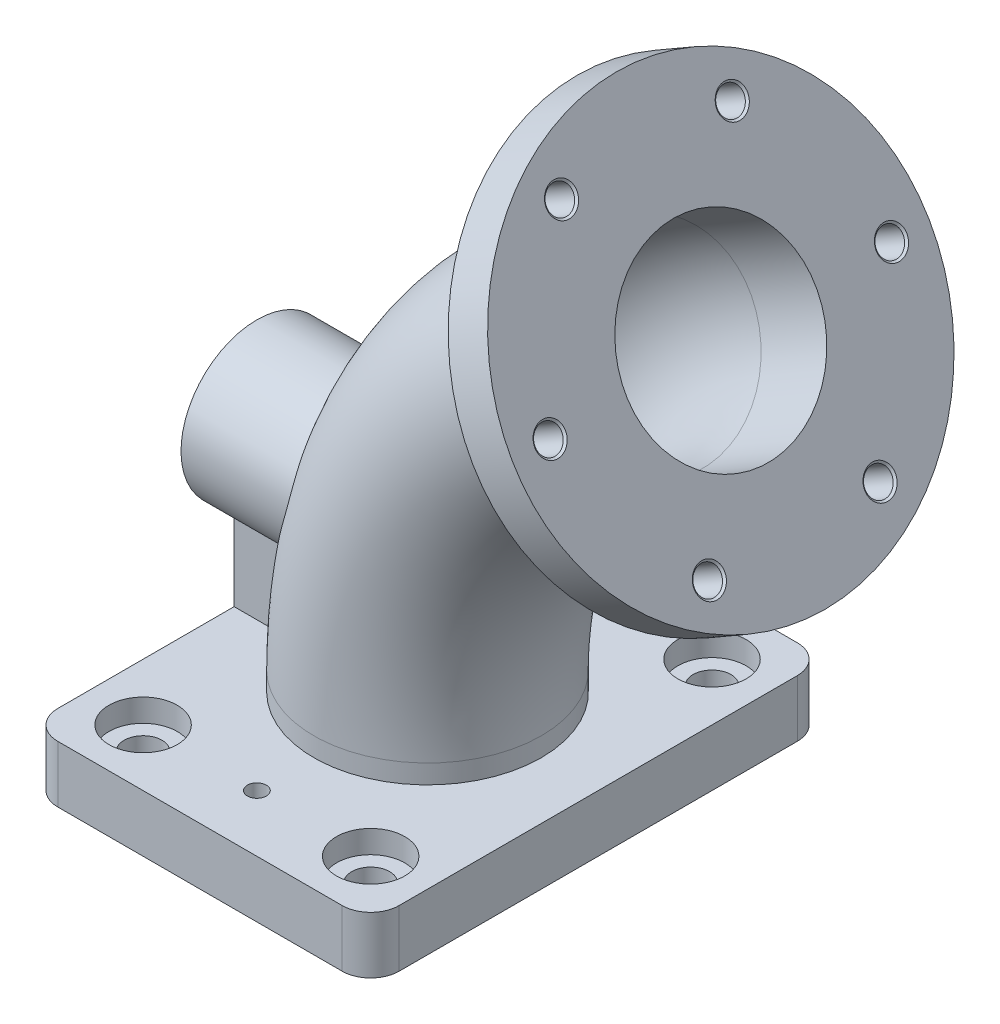
from build123d import *

# Parameters (mm, degrees)
SKETCH1_W                       = 90
SKETCH1_H                       = 15
BOSS_EXTRUDE1_DEPTH             = 60
SKETCH3_R                       = 30
SKETCH3_R_2                     = 25
SKETCH4_R                       = 55
SKETCH4_R_2                     = 25
BOSS_EXTRUDE2_DEPTH             = 12
M8X1_0_TAPPED_HOLE1_D           = 7
M8X1_0_TAPPED_HOLE1_CSINK_D     = 8.05
M8X1_0_TAPPED_HOLE1_CSINK_ANGLE = 90
FILLET1_R                       = 7.5
HOLE2_D                         = 10
HOLE2_CBORE_D                   = 18
HOLE2_CBORE_DEPTH               = 6
MIRROR2_COPY_1_D                = 10
MIRROR2_COPY_1_CBORE_D          = 18
MIRROR2_COPY_1_CBORE_DEPTH      = 6
HOLE3_D                         = 5
BOSS_EXTRUDE3_REACH             = 239.363
HOLE4_REACH                     = 239.363
HOLE4_BORE_R                    = 12.5


# Read off the part's stored shape, not the designer's step: CirPattern1
with BuildPart() as part:
    # Sketch1 → Boss-Extrude1 (new, symmetric)
    with BuildSketch(Plane.XY):
        Rectangle(SKETCH1_W, SKETCH1_H)
    extrude(amount=BOSS_EXTRUDE1_DEPTH, both=True)

    # Sweep1: sweep along a path in Sketch2
    with BuildLine(Plane.XY) as sweep1_path:
        Line((0, 7.5), (0, 12.5))
        ThreePointArc((0, 12.5), (16.076951546, 72.5), (60, 116.423048454))
        Line((60, 116.423048454), (77.320508076, 126.423048454))
    # Sketch3 → Sweep1 (sweep)
    with BuildSketch(Plane(origin=(0, 7.5, 0), x_dir=(1, 0, 0), z_dir=(0, 1, 0))):
        Circle(SKETCH3_R)
        Circle(SKETCH3_R_2, mode=Mode.SUBTRACT)
    sweep(path=sweep1_path.line)

    # Sketch4 → Boss-Extrude2 (add)
    with BuildSketch(Plane(origin=(112.733166849, 65.086524227, 0), x_dir=(0, 0, -1), z_dir=(0.8660254037844357, 0.5000000000000052, 0))):
        with Locations(Location((0, 70.825317547, 0), (0, 0, 90))):
            Circle(SKETCH4_R)
        with Locations(Location((0, 70.825317547, 0), (0, 0, 90))):
            Circle(SKETCH4_R_2, mode=Mode.SUBTRACT)
    extrude(amount=-BOSS_EXTRUDE2_DEPTH)

    # M8x1.0 Tapped Hole1 (through all)
    with Locations(Plane(origin=(112.733166849, 65.086524227, 0), x_dir=(0, 0, -1), z_dir=(0.8660254037844357, 0.5000000000000052, 0))):
        with Locations((45, 70.825317547)):
            CounterSinkHole(M8X1_0_TAPPED_HOLE1_D / 2, M8X1_0_TAPPED_HOLE1_CSINK_D / 2, counter_sink_angle=M8X1_0_TAPPED_HOLE1_CSINK_ANGLE)

    # CirPattern1 outline → CirPattern1 (revolve, cut)
    with BuildSketch(Plane(origin=(-15.927087189, 27.586524227, -22.5), x_dir=(0.5000000000000049, -0.8660254037844358, 0), z_dir=(0, 0, 1))):
        Polygon((0, 118.173048454), (3.5, 118.173048454), (3.5, 129.648048454), (4.025, 130.173048454), (0, 130.173048454), align=None)
    revolve(axis=Axis((-15.927087189, 27.586524227, -22.5), (0.8660254037844358, 0.5000000000000049, 0)), mode=Mode.SUBTRACT)

    # CirPattern1 2 outline → CirPattern1 2 (revolve, cut)
    with BuildSketch(Plane(origin=(-15.927087189, 27.586524227, 22.5), x_dir=(0.500000000000004, -0.8660254037844363, 0), z_dir=(0, 0, 1))):
        Polygon((0, 118.173048454), (3.5, 118.173048454), (3.5, 129.648048454), (4.025, 130.173048454), (0, 130.173048454), align=None)
    revolve(axis=Axis((-15.927087189, 27.586524227, 22.5), (0.8660254037844363, 0.500000000000004, 0)), mode=Mode.SUBTRACT)

    # CirPattern1 3 outline → CirPattern1 3 (revolve, cut)
    with BuildSketch(Plane(origin=(-35.412658774, 61.336524227, 45), x_dir=(0.500000000000004, -0.8660254037844363, 0), z_dir=(0, 0, 1))):
        Polygon((0, 118.173048454), (3.5, 118.173048454), (3.5, 129.648048454), (4.025, 130.173048454), (0, 130.173048454), align=None)
    revolve(axis=Axis((-35.412658774, 61.336524227, 45), (0.8660254037844363, 0.500000000000004, 0)), mode=Mode.SUBTRACT)

    # CirPattern1 4 outline → CirPattern1 4 (revolve, cut)
    with BuildSketch(Plane(origin=(-54.898230359, 95.086524227, 22.5), x_dir=(0.5000000000000049, -0.8660254037844358, 0), z_dir=(0, 0, 1))):
        Polygon((0, 118.173048454), (3.5, 118.173048454), (3.5, 129.648048454), (4.025, 130.173048454), (0, 130.173048454), align=None)
    revolve(axis=Axis((-54.898230359, 95.086524227, 22.5), (0.8660254037844358, 0.5000000000000049, 0)), mode=Mode.SUBTRACT)

    # CirPattern1 5 outline → CirPattern1 5 (revolve, cut)
    with BuildSketch(Plane(origin=(-54.898230359, 95.086524227, -22.5), x_dir=(0.5000000000000049, -0.8660254037844358, 0), z_dir=(0, 0, 1))):
        Polygon((0, 118.173048454), (3.5, 118.173048454), (3.5, 129.648048454), (4.025, 130.173048454), (0, 130.173048454), align=None)
    revolve(axis=Axis((-54.898230359, 95.086524227, -22.5), (0.8660254037844358, 0.5000000000000049, 0)), mode=Mode.SUBTRACT)

    # Fillet1
    fillet1_edges = [part.edges().sort_by_distance(p)[0] for p in [
        (-45, 0, 60),
        (45, 0, 60),
        (-45, 0, -60),
        (45, 0, -60),
    ]]
    fillet(fillet1_edges, radius=FILLET1_R)

    # Hole2 (through all)
    with Locations(Plane(origin=(0, 7.5, 0), x_dir=(1, 0, 0), z_dir=(0, 1, 0))):
        with Locations((-30, 45)):
            hole2 = CounterBoreHole(HOLE2_D / 2, HOLE2_CBORE_D / 2, HOLE2_CBORE_DEPTH)

    # Mirror1: Hole2 across plane
    add(hole2.mirror(Plane(origin=(0, 0, 0), x_dir=(0, 0, 1), z_dir=(1, 0, 0))), mode=Mode.SUBTRACT)

    # Mirror2: Hole2 across plane
    add(hole2.mirror(Plane.XY), mode=Mode.SUBTRACT)

    # Mirror2 copy 1 (through all)
    with Locations(Plane(origin=(0, 7.5, 0), x_dir=(-1, 0, 0), z_dir=(0, 1, 0))):
        with Locations((-30, 45)):
            CounterBoreHole(MIRROR2_COPY_1_D / 2, MIRROR2_COPY_1_CBORE_D / 2, MIRROR2_COPY_1_CBORE_DEPTH)

    # Hole3 (through all)
    with Locations(Plane(origin=(0, 7.5, 0), x_dir=(1, 0, 0), z_dir=(0, 1, 0))):
        with Locations((0, 45)):
            hole3 = Hole(HOLE3_D / 2)

    # Mirror3: Hole3 across plane
    add(hole3.mirror(Plane.XY), mode=Mode.SUBTRACT)

    # Sketch14 → Boss-Extrude3 (add, up to next)
    with BuildSketch(Plane(origin=(-45, 0, 0), x_dir=(0, 0, -1), z_dir=(1, 0, 0)), mode=Mode.PRIVATE) as boss_extrude3_sk1:
        with BuildLine():
            Line((6, 30.921215972), (6, -7.5))
            Line((6, -7.5), (-6, -7.5))
            Line((-6, -7.5), (-6, 30.921215972))
            ThreePointArc((-6, 30.921215972), (0, 70), (6, 30.921215972))
        make_face()
    boss_extrude3_tool1 = extrude(boss_extrude3_sk1.sketch, amount=BOSS_EXTRUDE3_REACH, mode=Mode.PRIVATE) - part.part
    add(boss_extrude3_tool1.solids().sort_by_distance((-45, 39.762246, 0))[0])

    # Hole4 bore → Hole4 (cut, up to next)
    with BuildSketch(Plane.ZY.offset(45), mode=Mode.PRIVATE) as hole4_sk1:
        with Locations((0, 50)):
            Circle(HOLE4_BORE_R)
    hole4_tool1 = extrude(hole4_sk1.sketch, amount=-HOLE4_REACH, mode=Mode.PRIVATE) & part.part
    add(hole4_tool1.solids().sort_by_distance((-45, 50, 0))[0], mode=Mode.SUBTRACT)


solid = part.part
